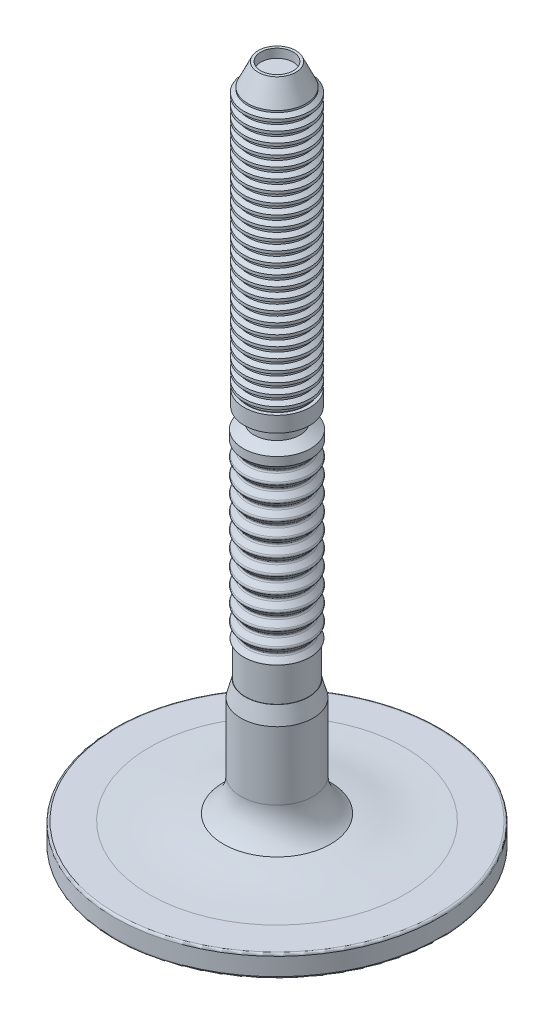
from build123d import *

# Parameters (mm, degrees)
SKETCH1_R           = 18.5
BOSS_EXTRUDE1_DEPTH = 2.5
SKETCH2_R           = 4.1
BOSS_EXTRUDE2_DEPTH = 14
SKETCH3_R           = 3.575
BOSS_EXTRUDE3_DEPTH = 4
SKETCH4_R           = 3.825
BOSS_EXTRUDE4_DEPTH = 21.3
SKETCH5_R           = 2.6
BOSS_EXTRUDE5_DEPTH = 0.75
SKETCH6_R           = 3.725
BOSS_EXTRUDE6_DEPTH = 2.5
SKETCH7_R           = 3.75
BOSS_EXTRUDE7_DEPTH = 32.2
CHAMFER2_SIZE       = 1.279985547
CHAMFER2_SIZE_2     = 0.739
CHAMFER3_SIZE       = 0.739
CHAMFER3_SIZE_2     = 1.279985547
CHAMFER4_SIZE       = 1.835
CHAMFER4_SIZE2      = 0.491686768
CHAMFER5_SIZE       = 2.5
CHAMFER5_SIZE2      = 1.165769145
SKETCH14_R          = 1.843730855
CUT_EXTRUDE2_DEPTH  = 1
FILLET1_R           = 4.453
FILLET2_R           = 0.25


with BuildPart() as part:
    # Sketch1 → Boss-Extrude1 (new body)
    with BuildSketch(Plane(origin=(0, 0, 0), x_dir=(1, 0, 0), z_dir=(0, 1, 0))):
        with Locations(Location((0, 0, 0), (0, 0, 270))):
            Circle(SKETCH1_R)
    extrude(amount=BOSS_EXTRUDE1_DEPTH)

    # Sketch2 → Boss-Extrude2 (add)
    with BuildSketch(Plane(origin=(0, 2.5, 0), x_dir=(1, 0, 0), z_dir=(0, 1, 0))):
        with Locations(Location((0, 0, 0), (0, 0, 270))):
            Circle(SKETCH2_R)
    extrude(amount=BOSS_EXTRUDE2_DEPTH)

    # Sketch3 → Boss-Extrude3 (add)
    with BuildSketch(Plane(origin=(0, 16.5, 0), x_dir=(1, 0, 0), z_dir=(0, 1, 0))):
        with Locations(Location((0, 0, 0), (0, 0, 270))):
            Circle(SKETCH3_R)
    extrude(amount=BOSS_EXTRUDE3_DEPTH)

    # Sketch4 → Boss-Extrude4 (add)
    with BuildSketch(Plane(origin=(0, 20.5, 0), x_dir=(1, 0, 0), z_dir=(0, 1, 0))):
        with Locations(Location((0, 0, 0), (0, 0, 270))):
            Circle(SKETCH4_R)
    extrude(amount=BOSS_EXTRUDE4_DEPTH)

    # Sketch5 → Boss-Extrude5 (add)
    with BuildSketch(Plane(origin=(0, 41.8, 0), x_dir=(1, 0, 0), z_dir=(0, 1, 0))):
        with Locations(Location((0, 0, 0), (0, 0, 270))):
            Circle(SKETCH5_R)
    extrude(amount=BOSS_EXTRUDE5_DEPTH)

    # Sketch6 → Boss-Extrude6 (add)
    with BuildSketch(Plane(origin=(0, 42.55, 0), x_dir=(1, 0, 0), z_dir=(0, 1, 0))):
        with Locations(Location((0, 0, 0), (0, 0, 270))):
            Circle(SKETCH6_R)
    extrude(amount=BOSS_EXTRUDE6_DEPTH)

    # Sketch7 → Boss-Extrude7 (add)
    with BuildSketch(Plane(origin=(0, 45.05, 0), x_dir=(1, 0, 0), z_dir=(0, 1, 0))):
        with Locations(Location((0, 0, 0), (0, 0, 270))):
            Circle(SKETCH7_R)
    extrude(amount=BOSS_EXTRUDE7_DEPTH)

    # Chamfer2
    # the kernel refuses this chamfer: 1.279985547, 0.739 mm, written as the material it takes off along each edge
    with BuildSketch(Plane(origin=(0, 41.8, 0), x_dir=(0, 0, 1), z_dir=(-1, 0, 0))) as chamfer2_piece_1_section:
        Polygon((3.825 - CHAMFER2_SIZE, 0), (3.825, -CHAMFER2_SIZE_2), (3.825, 0), align=None)
    chamfer2_piece_1 = revolve(axis=Axis((0, 41.8, 0), (0, 1, 0)), mode=Mode.PRIVATE)
    chamfer2_piece_1 = chamfer2_piece_1 - Plane(origin=(0, 41.421302908, 0), x_dir=(0, 0, 1), z_dir=(0, -1, 0)) * Cylinder(2.6, 16, mode=Mode.PRIVATE)
    add(chamfer2_piece_1, mode=Mode.SUBTRACT)

    # Chamfer3
    # the kernel refuses this chamfer: 1.279985547, 0.739 mm, written as the material it takes off along each edge
    with BuildSketch(Plane(origin=(0, 42.55, 0), x_dir=(0, 0, 1), z_dir=(-1, 0, 0))) as chamfer3_piece_1_section:
        Polygon((3.725, CHAMFER3_SIZE), (3.725 - CHAMFER3_SIZE_2, 0), (3.725, 0), align=None)
    chamfer3_piece_1 = revolve(axis=Axis((0, 42.55, 0), (0, 1, 0)), mode=Mode.PRIVATE)
    chamfer3_piece_1 = chamfer3_piece_1 - Plane(origin=(0, 42.957854743, 0), x_dir=(0, 0, 1), z_dir=(0, -1, 0)) * Cylinder(2.6, 15, mode=Mode.PRIVATE)
    add(chamfer3_piece_1, mode=Mode.SUBTRACT)

    # Chamfer4
    chamfer4_edges = [part.edges().sort_by_distance(p)[0] for p in [
        (0, 16.5, -4.1),
    ]]
    chamfer4_side = [part.faces().sort_by_distance(p)[0] for p in [
        (0, 9.5, -4.1),
    ]]
    chamfer(chamfer4_edges, length=CHAMFER4_SIZE, length2=CHAMFER4_SIZE2, reference=chamfer4_side[0])

    # Sketch12 → Cut-Revolve1 (revolve, cut)
    with BuildSketch(Plane.XY, mode=Mode.PRIVATE) as cut_revolve1_sk:
        with BuildLine():
            Line((-3.825, 41.061), (-3.825, 40.061))
            Line((-3.825, 40.061), (-3.317111112, 39.455721593))
            ThreePointArc((-3.317111112, 39.455721593), (-3.262846056, 39.361731759), (-3.244, 39.254850464))
            Line((-3.244, 39.254850464), (-3.244, 39.251831861))
            ThreePointArc((-3.244, 39.251831861), (-3.262846056, 39.144950566), (-3.317111112, 39.050960733))
            Line((-3.317111112, 39.050960733), (-3.765647081, 38.516416379))
            ThreePointArc((-3.765647081, 38.516416379), (-3.825001606, 38.353341163), (-3.765647081, 38.190265946))
            Line((-3.765647081, 38.190265946), (-3.317111112, 37.655721593))
            ThreePointArc((-3.317111112, 37.655721593), (-3.262846056, 37.561731759), (-3.244, 37.454850464))
            Line((-3.244, 37.454850464), (-3.244, 37.451831861))
            ThreePointArc((-3.244, 37.451831861), (-3.262846056, 37.344950566), (-3.317111112, 37.250960733))
            Line((-3.317111112, 37.250960733), (-3.765647081, 36.716416379))
            ThreePointArc((-3.765647081, 36.716416379), (-3.825001606, 36.553341163), (-3.765647081, 36.390265946))
            Line((-3.765647081, 36.390265946), (-3.317111112, 35.855721593))
            ThreePointArc((-3.317111112, 35.855721593), (-3.262846056, 35.761731759), (-3.244, 35.654850464))
            Line((-3.244, 35.654850464), (-3.244, 35.651831861))
            ThreePointArc((-3.244, 35.651831861), (-3.262846056, 35.544950566), (-3.317111112, 35.450960733))
            Line((-3.317111112, 35.450960733), (-3.765647081, 34.916416379))
            ThreePointArc((-3.765647081, 34.916416379), (-3.825001606, 34.753341163), (-3.765647081, 34.590265946))
            Line((-3.765647081, 34.590265946), (-3.317111112, 34.055721593))
            ThreePointArc((-3.317111112, 34.055721593), (-3.262846056, 33.961731759), (-3.244, 33.854850464))
            Line((-3.244, 33.854850464), (-3.244, 33.851831861))
            ThreePointArc((-3.244, 33.851831861), (-3.262846056, 33.744950566), (-3.317111112, 33.650960733))
            Line((-3.317111112, 33.650960733), (-3.765647081, 33.116416379))
            ThreePointArc((-3.765647081, 33.116416379), (-3.825001606, 32.953341163), (-3.765647081, 32.790265946))
            Line((-3.765647081, 32.790265946), (-3.317111112, 32.255721593))
            ThreePointArc((-3.317111112, 32.255721593), (-3.262846056, 32.161731759), (-3.244, 32.054850464))
            Line((-3.244, 32.054850464), (-3.244, 32.051831861))
            ThreePointArc((-3.244, 32.051831861), (-3.262846056, 31.944950566), (-3.317111112, 31.850960733))
            Line((-3.317111112, 31.850960733), (-3.765647081, 31.316416379))
            ThreePointArc((-3.765647081, 31.316416379), (-3.825001606, 31.153341163), (-3.765647081, 30.990265946))
            Line((-3.765647081, 30.990265946), (-3.317111112, 30.455721593))
            ThreePointArc((-3.317111112, 30.455721593), (-3.262846056, 30.361731759), (-3.244, 30.254850464))
            Line((-3.244, 30.254850464), (-3.244, 30.251831861))
            ThreePointArc((-3.244, 30.251831861), (-3.262846056, 30.144950566), (-3.317111112, 30.050960733))
            Line((-3.317111112, 30.050960733), (-3.765647081, 29.516416379))
            ThreePointArc((-3.765647081, 29.516416379), (-3.825001606, 29.353341163), (-3.765647081, 29.190265946))
            Line((-3.765647081, 29.190265946), (-3.317111112, 28.655721593))
            ThreePointArc((-3.317111112, 28.655721593), (-3.262846056, 28.561731759), (-3.244, 28.454850464))
            Line((-3.244, 28.454850464), (-3.244, 28.451831861))
            ThreePointArc((-3.244, 28.451831861), (-3.262846056, 28.344950566), (-3.317111112, 28.250960733))
            Line((-3.317111112, 28.250960733), (-3.765647081, 27.716416379))
            ThreePointArc((-3.765647081, 27.716416379), (-3.825001606, 27.553341163), (-3.765647081, 27.390265946))
            Line((-3.765647081, 27.390265946), (-3.317111112, 26.855721593))
            ThreePointArc((-3.317111112, 26.855721593), (-3.262846056, 26.761731759), (-3.244, 26.654850464))
            Line((-3.244, 26.654850464), (-3.244, 26.651831861))
            ThreePointArc((-3.244, 26.651831861), (-3.262846056, 26.544950566), (-3.317111112, 26.450960733))
            Line((-3.317111112, 26.450960733), (-3.765647081, 25.916416379))
            ThreePointArc((-3.765647081, 25.916416379), (-3.825001606, 25.753341163), (-3.765647081, 25.590265946))
            Line((-3.765647081, 25.590265946), (-3.317111112, 25.055721593))
            ThreePointArc((-3.317111112, 25.055721593), (-3.262846056, 24.961731759), (-3.244, 24.854850464))
            Line((-3.244, 24.854850464), (-3.244, 24.851831861))
            ThreePointArc((-3.244, 24.851831861), (-3.262846056, 24.744950566), (-3.317111112, 24.650960733))
            Line((-3.317111112, 24.650960733), (-3.765647081, 24.116416379))
            ThreePointArc((-3.765647081, 24.116416379), (-3.825001606, 23.953341163), (-3.765647081, 23.790265946))
            Line((-3.765647081, 23.790265946), (-3.317111112, 23.255721593))
            ThreePointArc((-3.317111112, 23.255721593), (-3.262846056, 23.161731759), (-3.244, 23.054850464))
            Line((-3.244, 23.054850464), (-3.244, 23.051831861))
            ThreePointArc((-3.244, 23.051831861), (-3.262846056, 22.944950566), (-3.317111112, 22.850960733))
            Line((-3.317111112, 22.850960733), (-3.765647081, 22.316416379))
            ThreePointArc((-3.765647081, 22.316416379), (-3.825001606, 22.153341163), (-3.765647081, 21.990265946))
            Line((-3.765647081, 21.990265946), (-3.317111112, 21.455721593))
            ThreePointArc((-3.317111112, 21.455721593), (-3.262846056, 21.361731759), (-3.244, 21.254850464))
            Line((-3.244, 21.254850464), (-3.244, 21.251831861))
            ThreePointArc((-3.244, 21.251831861), (-3.262846056, 21.144950566), (-3.317111112, 21.050960733))
            Line((-3.317111112, 21.050960733), (-3.765647081, 20.516416379))
            ThreePointArc((-3.765647081, 20.516416379), (-3.772149235, 20.508337679), (-3.778315798, 20.5))
            Line((-3.778315798, 20.5), (-4.049772444, 20.5))
            Line((-4.049772444, 20.5), (-4.049772444, 41.061))
            Line((-4.049772444, 41.061), (-3.825, 41.061))
        make_face()
    revolve(cut_revolve1_sk.sketch.rotate(Axis((0, 0, 0), (0, 1, 0)), 270), axis=Axis((0, 0, 0), (0, 1, 0)), mode=Mode.SUBTRACT)

    # Sketch13 → Cut-Revolve2 (revolve, cut)
    with BuildSketch(Plane.XY, mode=Mode.PRIVATE) as cut_revolve2_sk:
        Polygon((3.3095, 74.55), (3.75, 74.216), (3.75, 73.897), (3.3095, 73.72), (3.3095, 73.371), (3.75, 73.037), (3.75, 72.718), (3.3095, 72.541), (3.3095, 72.192), (3.75, 71.858), (3.75, 71.539), (3.3095, 71.362), (3.3095, 71.013), (3.75, 70.679), (3.75, 70.36), (3.3095, 70.183), (3.3095, 69.834), (3.75, 69.5), (3.75, 69.181), (3.3095, 69.004), (3.3095, 68.655), (3.75, 68.321), (3.75, 68.002), (3.3095, 67.825), (3.3095, 67.476), (3.75, 67.142), (3.75, 66.823), (3.3095, 66.646), (3.3095, 66.297), (3.75, 65.963), (3.75, 65.644), (3.3095, 65.467), (3.3095, 65.118), (3.75, 64.784), (3.75, 64.465), (3.3095, 64.288), (3.3095, 63.939), (3.75, 63.605), (3.75, 63.286), (3.3095, 63.109), (3.3095, 62.76), (3.75, 62.426), (3.75, 62.107), (3.3095, 61.93), (3.3095, 61.581), (3.75, 61.247), (3.75, 60.928), (3.3095, 60.751), (3.3095, 60.402), (3.75, 60.068), (3.75, 59.749), (3.3095, 59.572), (3.3095, 59.223), (3.75, 58.889), (3.75, 58.57), (3.3095, 58.393), (3.3095, 58.044), (3.75, 57.71), (3.75, 57.391), (3.3095, 57.214), (3.3095, 56.865), (3.75, 56.531), (3.75, 56.212), (3.3095, 56.035), (3.3095, 55.686), (3.75, 55.352), (3.75, 55.033), (3.3095, 54.856), (3.3095, 54.507), (3.75, 54.173), (3.75, 53.854), (3.3095, 53.677), (3.3095, 53.328), (3.75, 52.994), (3.75, 52.675), (3.3095, 52.498), (3.3095, 52.149), (3.75, 51.815), (3.75, 51.496), (3.3095, 51.319), (3.3095, 50.97), (3.75, 50.636), (3.75, 50.317), (3.3095, 50.14), (3.3095, 49.791), (3.75, 49.457), (3.75, 49.138), (3.3095, 48.961), (3.3095, 48.612), (3.75, 48.278), (3.75, 47.959), (3.3095, 47.782), (3.3095, 47.433), (3.75, 47.099), (3.75, 46.78), (3.3095, 46.603), (3.3095, 46.254), (3.75, 45.92), (3.75, 45.601), (3.3095, 45.424), (3.3095, 45.075), (3.342471557, 45.05), (3.75, 45.05), (5.136813564, 45.05), (5.136813564, 75.05), (5.136813564, 77.616462755), (3.3095, 77.616462755), (3.3095, 75.05), align=None)
    revolve(cut_revolve2_sk.sketch.rotate(Axis((0, 0, 0), (0, 1, 0)), 90), axis=Axis((0, 0, 0), (0, 1, 0)), mode=Mode.SUBTRACT)

    # Chamfer5
    chamfer5_edges = [part.edges().sort_by_distance(p)[0] for p in [
        (0, 77.25, 3.3095),
    ]]
    chamfer5_side = [part.faces().sort_by_distance(p)[0] for p in [
        (0, 75.9, 3.3095),
    ]]
    chamfer(chamfer5_edges, length=CHAMFER5_SIZE, length2=CHAMFER5_SIZE2, reference=chamfer5_side[0])

    # Sketch14 → Cut-Extrude2 (cut)
    with BuildSketch(Plane(origin=(0, 77.25, 0), x_dir=(1, 0, 0), z_dir=(0, 1, 0))):
        with Locations(Location((0, 0, 0), (0, 0, 270))):
            Circle(SKETCH14_R)
    extrude(amount=-CUT_EXTRUDE2_DEPTH, mode=Mode.SUBTRACT)

    # Fillet1
    fillet1_edges = [part.edges().sort_by_distance(p)[0] for p in [
        (0, 2.5, -4.1),
    ]]
    fillet(fillet1_edges, radius=FILLET1_R)

    # Sketch16 → Revolve1 (revolve)
    with BuildSketch(Plane(origin=(0, 0, 0), x_dir=(0, 0, -1), z_dir=(1, 0, 0)), mode=Mode.PRIVATE) as revolve1_sk:
        with BuildLine():
            Line((-6.0775, 3.25), (-6.0775, 2.5))
            Line((-6.0775, 2.5), (-14.5, 2.5))
            add(Edge.make_bspline(
                [(-14.5, 2.5), (-9.191055047, 2.560284995), (-10.096341637, 2.80022345), (-6.0775, 3.25)],
                knots=[0, 0, 0, 0, 1, 1, 1, 1], degree=3))
        make_face()
    revolve(revolve1_sk.sketch.rotate(Axis((0, 2.5, 0), (0, 1, 0)), 180), axis=Axis((0, 2.5, 0), (0, 1, 0)))

    # Sketch18 → Cut-Revolve3 (revolve, cut)
    with BuildSketch(Plane.XY, mode=Mode.PRIVATE) as cut_revolve3_sk:
        with BuildLine():
            Line((0, 0), (-6, 0))
            add(Edge.make_bspline(
                [(-6, 0), (-6.130450803, -0.005902083), (-6.276857439, 0.291928399), (-6.659286461, 0.673122163), (-7.071855826, 0.170950348), (-7.1, 0)],
                knots=[0, 0, 0, 0, 0.332582142, 0.483763556, 1, 1, 1, 1], degree=3))
            Line((-7.1, 0), (-8.5, 0))
            add(Edge.make_bspline(
                [(-8.5, 0), (-8.656388741, 0.005749794), (-8.776376104, 0.281952298), (-8.987942502, 0.517516404), (-9.408762415, 0.447462119), (-9.888283231, 0.026188103), (-9.9, 0)],
                knots=[0, 0, 0, 0, 0.285925992, 0.415898983, 0.487306384, 1, 1, 1, 1], degree=3))
            Line((-9.9, 0), (-11.25, 0))
            add(Edge.make_bspline(
                [(-11.25, 0), (-11.413278403, -0.009126002), (-11.526216759, 0.28348045), (-11.73975849, 0.522913253), (-12.22045117, 0.41574514), (-12.787422304, 0.024634935), (-12.8, 0)],
                knots=[0, 0, 0, 0, 0.265685682, 0.386458063, 0.459889495, 1, 1, 1, 1], degree=3))
            Line((-12.8, 0), (-13.7, 0))
            add(Edge.make_bspline(
                [(-13.7, 0), (-13.863755435, 0.001817425), (-13.974917682, 0.277731945), (-14.187962909, 0.52368873), (-14.60889866, 0.416883089), (-15.088439745, 0.025838279), (-15.1, 0)],
                knots=[0, 0, 0, 0, 0.285925992, 0.415898983, 0.487306384, 1, 1, 1, 1], degree=3))
            Line((-15.1, 0), (-16.4, 0))
            add(Edge.make_bspline(
                [(-16.4, 0), (-16.558477757, 0.007453402), (-16.677248011, 0.284815551), (-16.89074119, 0.518356837), (-17.389729829, 0.44297333), (-17.986947531, 0.02466444), (-18, 0)],
                knots=[0, 0, 0, 0, 0.259428194, 0.377356117, 0.451413297, 1, 1, 1, 1], degree=3))
            Line((-18, 0), (-18.5, 0))
            Line((-18.5, 0), (-20.247565379, 0))
            Line((-20.247565379, 0), (-20.247565379, -1.840311221))
            Line((-20.247565379, -1.840311221), (0, -1.840311221))
            Line((0, -1.840311221), (0, 0))
        make_face()
    revolve(cut_revolve3_sk.sketch.rotate(Axis((0, -1.840311221, 0), (0, 1, 0)), 270), axis=Axis((0, -1.840311221, 0), (0, 1, 0)), mode=Mode.SUBTRACT)

    # Fillet2
    fillet2_edges = [part.edges().sort_by_distance(p)[0] for p in [
        (0, 0, -18.5),
        (0, 2.5, -18.5),
    ]]
    fillet(fillet2_edges, radius=FILLET2_R)


solid = part.part
